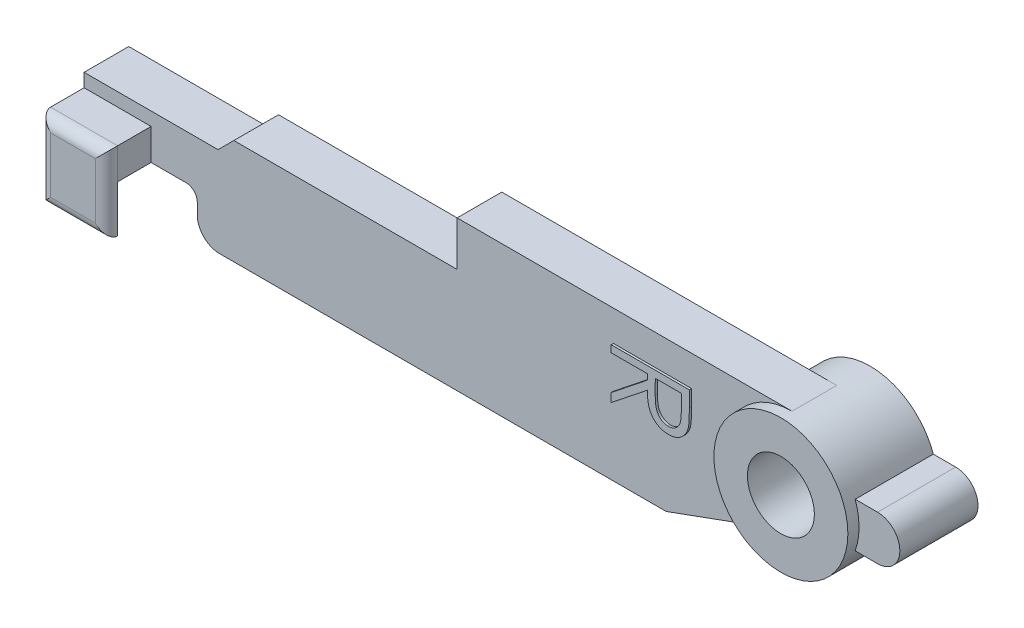
from build123d import *

# Parameters (mm, degrees)
ESTRUSIONE_ESTRUSIONE1_DEPTH             = 2
RACCORDO1_R                              = 1
RACCORDO2_R                              = 0.5
ESTRUSIONE_ESTRUSIONE2_DEPTH             = 2.5
ESTRUSIONE_ESTRUSIONE2_DEPTH_BACK        = 1.5
SCHIZZO2_R                               = 3
ESTRUSIONE_ESTRUSIONE3_REACH             = 20.547
ESTRUSIONE_ESTRUSIONE3_DIRECTION_2_REACH = 20.547
ESTRUSIONE_ESTRUSIONE4_DEPTH             = 3
RACCORDO3_R                              = 0.5
SCHIZZO5_R                               = 1.5
TAGLIO_ESTRUSIONE1_DEPTH                 = 21.58301689
ESTRUSIONE_ESTRUSIONE5_DEPTH             = 0.1


with BuildPart() as part:
    # Schizzo1 → Estrusione-Estrusione1 (new body)
    with BuildSketch(Plane.XY):
        Polygon((-16.707106781, 0.292893219), (-10.707106781, 0.292893219), (-10, 1), (0, 1), (0, 3), (15, 3), (15, 0), (15, -1.654985921), (9.361844275, -3.707106781), (-11.638155725, -3.707106781), (-11.638155725, -1.707106781), (-16.707106781, -1.707106781), align=None)
    extrude(amount=ESTRUSIONE_ESTRUSIONE1_DEPTH)

    # Raccordo1
    raccordo1_edges = [part.edges().sort_by_distance(p)[0] for p in [
        (-11.638155725, -3.707106781, 1),
    ]]
    fillet(raccordo1_edges, radius=RACCORDO1_R)

    # Raccordo2
    raccordo2_edges = [part.edges().sort_by_distance(p)[0] for p in [
        (-11.638155725, -1.707106781, 1),
    ]]
    fillet(raccordo2_edges, radius=RACCORDO2_R)

    # Schizzo2 → Estrusione-Estrusione2 (add, two sides: drawn at the far end of the back side and taken through both)
    with BuildSketch(Plane.XY.offset(-ESTRUSIONE_ESTRUSIONE2_DEPTH_BACK)):
        with Locations((15, 0)):
            Circle(SCHIZZO2_R)
    extrude(amount=ESTRUSIONE_ESTRUSIONE2_DEPTH + ESTRUSIONE_ESTRUSIONE2_DEPTH_BACK)

    # Estrusione-Estrusione3: up to this face of the body (flat: up to its plane)
    estrusione_estrusione3_end = Plane(part.part.faces().sort_by_distance((0.378494116, -0.704899382, 2))[0])
    # Schizzo3 → Estrusione-Estrusione3 (add, up to the picked face)
    with BuildSketch(Plane.XY, mode=Mode.PRIVATE) as estrusione_estrusione3_sk1:
        with BuildLine():
            Line((18.828427125, 1), (17.828427125, 1))
            ThreePointArc((17.828427125, 1), (18, 0), (17.828427125, -1))
            Line((17.828427125, -1), (18.828427125, -1))
            ThreePointArc((18.828427125, -1), (19.828427125, 0), (18.828427125, 1))
        make_face()
    estrusione_estrusione3_tool1 = split(extrude(estrusione_estrusione3_sk1.sketch, amount=ESTRUSIONE_ESTRUSIONE3_REACH, mode=Mode.PRIVATE), bisect_by=estrusione_estrusione3_end, keep=Keep.BOTH, mode=Mode.PRIVATE)
    add(estrusione_estrusione3_tool1.solids().sort_by(Axis((18.792788, 0, 0), (0, 0, 1)))[0])

    # Estrusione-Estrusione3 direction 2: up to this face of the body (flat: up to its plane)
    estrusione_estrusione3_direction_2_end = Plane(part.part.faces().sort_by_distance((15, 0, -1.5))[0])
    # Schizzo3 → Estrusione-Estrusione3 direction 2 (add, up to the picked face)
    with BuildSketch(Plane.XY, mode=Mode.PRIVATE) as estrusione_estrusione3_direction_2_sk1:
        with BuildLine():
            Line((18.828427125, 1), (17.828427125, 1))
            ThreePointArc((17.828427125, 1), (18, 0), (17.828427125, -1))
            Line((17.828427125, -1), (18.828427125, -1))
            ThreePointArc((18.828427125, -1), (19.828427125, 0), (18.828427125, 1))
        make_face()
    estrusione_estrusione3_direction_2_tool1 = split(extrude(estrusione_estrusione3_direction_2_sk1.sketch, amount=-ESTRUSIONE_ESTRUSIONE3_DIRECTION_2_REACH, mode=Mode.PRIVATE), bisect_by=estrusione_estrusione3_direction_2_end, keep=Keep.BOTH, mode=Mode.PRIVATE)
    add(estrusione_estrusione3_direction_2_tool1.solids().sort_by(Axis((18.792788, 0, 0), (0, 0, -1)))[0])

    # Schizzo4 → Estrusione-Estrusione4 (add)
    with BuildSketch(Plane.ZY.offset(16.707106781)):
        Polygon((2, -1.707106781), (3.5, -1.707106781), (3.5, -3.807106781), (4, -3.807106781), (4, -0.307106781), (2, -0.307106781), align=None)
    extrude(amount=-ESTRUSIONE_ESTRUSIONE4_DEPTH)

    # Raccordo3
    raccordo3_edges = [part.edges().sort_by_distance(p)[0] for p in [
        (-15.207106781, -0.307106781, 4),
        (-13.707106781, -2.057106781, 4),
        (-15.207106781, -3.807106781, 4),
        (-16.707106781, -2.057106781, 4),
    ]]
    fillet(raccordo3_edges, radius=RACCORDO3_R - 0.0001)  # a hair under: the kernel refuses the full size

    # Schizzo5 → Taglio-Estrusione1 (cut, through all)
    with BuildSketch(Plane.XY.offset(2.5)):
        with Locations((15, 0)):
            Circle(SCHIZZO5_R)
    extrude(amount=-TAGLIO_ESTRUSIONE1_DEPTH, mode=Mode.SUBTRACT)

    # Schizzo6 → Estrusione-Estrusione5 (add)
    with BuildSketch(Plane.XY.offset(2)):
        with BuildLine():
            Line((10.5, 1.629867893), (10.5, 0.92944722))
            add(Edge.make_bspline(
                [(10.5, 0.92944722), (10.499844414, 0.882706092), (10.499545672, 0.792957947), (10.497879909, 0.664384677), (10.493105553, 0.54755758), (10.48899697, 0.442537741), (10.481505028, 0.349327086), (10.474344381, 0.267639795), (10.46497072, 0.197852097), (10.456265297, 0.155606246), (10.452323718, 0.13647847)],
                knots=[0, 0, 0, 0, 1.410062039, 2.707475311, 3.878576406, 4.937260626, 5.877586885, 6.699081471, 7.410979367, 8, 8, 8, 8], degree=3))
            add(Edge.make_bspline(
                [(10.452323718, 0.13647847), (10.44599767, 0.110871395), (10.433480527, 0.060203513), (10.407010513, -0.012740009), (10.376429305, -0.082278475), (10.340231746, -0.148150926), (10.299049203, -0.210363472), (10.252641058, -0.268822966), (10.200770974, -0.323195178), (10.144763494, -0.373898474), (10.084129937, -0.419859381), (10.019753567, -0.459632532), (9.952037023, -0.493690082), (9.88074449, -0.520879248), (9.80647863, -0.542752098), (9.72859096, -0.55817975), (9.647429673, -0.567430547), (9.592071808, -0.568372457), (9.564002404, -0.568850055)],
                knots=[0, 0, 0, 0, 1.02737288, 2.032829108, 3.019628684, 3.985738875, 4.958353778, 5.924249254, 6.890702889, 7.883913451, 8.865824512, 9.85161466, 10.829249435, 11.81541824, 12.821369441, 13.843154991, 14.906364023, 16, 16, 16, 16], degree=3))
            add(Edge.make_bspline(
                [(9.564002404, -0.568850055), (9.517367246, -0.567381095), (9.426369973, -0.564514774), (9.294309841, -0.537789138), (9.171117785, -0.494014565), (9.056965246, -0.433684102), (8.954017226, -0.356891178), (8.863900454, -0.264603546), (8.787792734, -0.157292512), (8.735576131, -0.056923958), (8.70197773, 0.031778426), (8.678219098, 0.105018096), (8.660172121, 0.18497086), (8.643769941, 0.270489675), (8.631253759, 0.362235095), (8.622364892, 0.460022369), (8.616649282, 0.564096068), (8.615814207, 0.635435829), (8.615384615, 0.672135521)],
                knots=[0, 0, 0, 0, 1.260402266, 2.459371274, 3.627181936, 4.786749125, 5.93865593, 7.087644312, 8.261344208, 9.485713728, 10.136162886, 10.825977872, 11.566646758, 12.35154167, 13.181268117, 14.0701832, 15.007234106, 16, 16, 16, 16], degree=3))
            Line((8.615384615, 0.672135521), (7, -0.61372185))
            Line((7, -0.61372185), (7, -0.225300376))
            Line((7, -0.225300376), (8.615384615, 1.060556996))
            Line((8.615384615, 1.060556996), (8.615384615, 1.315765329))
            Line((8.615384615, 1.315765329), (7, 1.315765329))
            Line((7, 1.315765329), (7, 1.629867893))
            Line((7, 1.629867893), (10.5, 1.629867893))
        make_face()
        with BuildLine():
            Line((10.141025641, 1.315765329), (8.974358974, 1.315765329))
            Line((8.974358974, 1.315765329), (8.969451122, 0.674940009))
            add(Edge.make_bspline(
                [(8.969451122, 0.674940009), (8.969437885, 0.64501997), (8.969412229, 0.587026413), (8.973406004, 0.503125746), (8.977949327, 0.425005641), (8.984898657, 0.352964869), (8.993854777, 0.286971357), (9.005057604, 0.227057739), (9.01811018, 0.173127354), (9.038309643, 0.110226003), (9.070330282, 0.040008487), (9.116838436, -0.036397556), (9.175714061, -0.101242729), (9.241967426, -0.157151837), (9.316309813, -0.200216089), (9.395441443, -0.23155931), (9.478679147, -0.251228927), (9.53585099, -0.253567367), (9.564703526, -0.254747491)],
                knots=[0, 0, 0, 0, 1.14660753, 2.222451964, 3.218720504, 4.145691244, 4.995719623, 5.770487122, 6.480909919, 7.121111896, 8.299844659, 9.430703709, 10.534634535, 11.641396424, 12.741395289, 13.810956493, 14.895269934, 16, 16, 16, 16], degree=3))
            add(Edge.make_bspline(
                [(9.564703526, -0.254747491), (9.592857905, -0.253563739), (9.648649611, -0.251217974), (9.730103047, -0.231521199), (9.807529909, -0.199713788), (9.879454388, -0.155112436), (9.94528638, -0.101218543), (10.000835297, -0.037211531), (10.047354277, 0.033685128), (10.076864421, 0.09999535), (10.094992971, 0.159223507), (10.107734135, 0.210655613), (10.118056983, 0.268990383), (10.126082803, 0.334088015), (10.133305124, 0.405830736), (10.137987885, 0.484414991), (10.140818147, 0.569750034), (10.140954867, 0.628897216), (10.141025641, 0.659515329)],
                knots=[0, 0, 0, 0, 1.100801541, 2.181386982, 3.260112282, 4.364594493, 5.481957178, 6.577424609, 7.668452592, 8.790448866, 9.403819393, 10.091598921, 10.863153553, 11.720938239, 12.658472417, 13.685008818, 14.801622349, 16, 16, 16, 16], degree=3))
            Line((10.141025641, 0.659515329), (10.141025641, 1.315765329))
        make_face(mode=Mode.SUBTRACT)
    extrude(amount=ESTRUSIONE_ESTRUSIONE5_DEPTH)


solid = part.part
